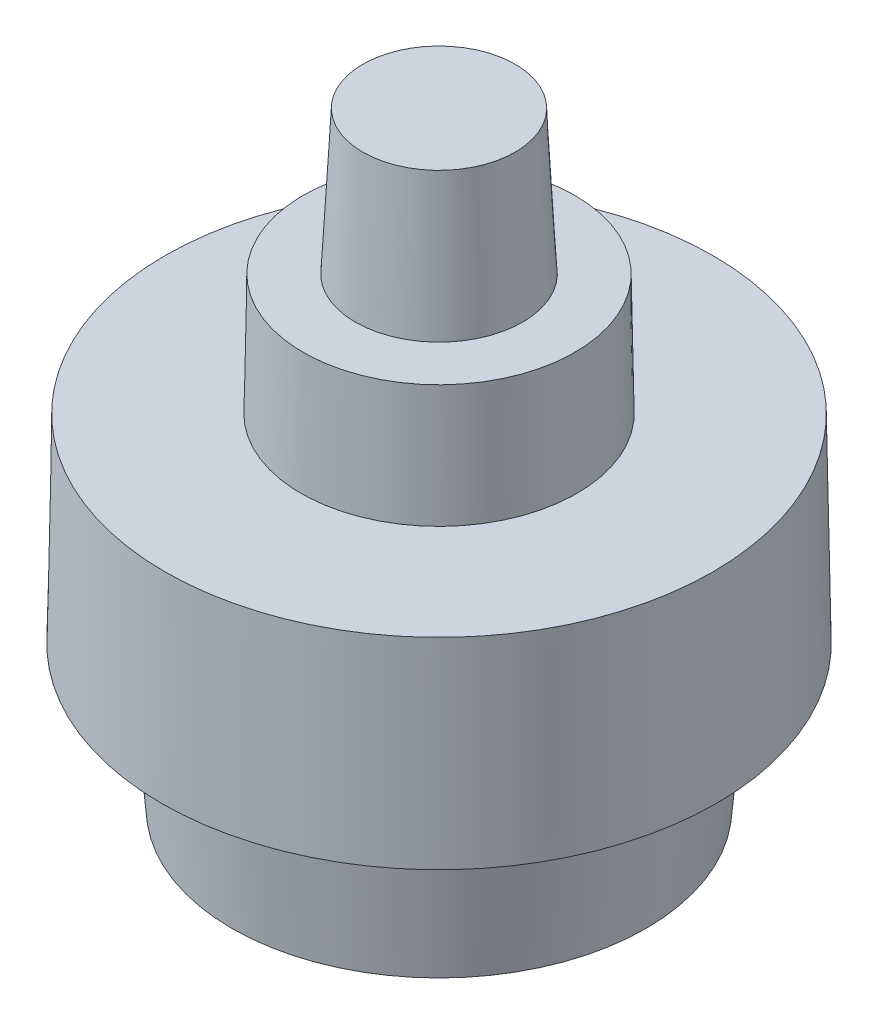
from build123d import *

# Parameters (mm, degrees)
SCALE1_SCALE             = 1.015
MOVE_START               = -3.416970763
MOVE_FACE1_OUTLINE_R     = 56.84
MOVE_FACE1_OUTLINE_R_2   = 45.72
MOVE_FACE1_DEPTH         = 31.42
MOVE_START_2             = 28.003029237
MOVE_FACE1_2_OUTLINE_R   = 28.42
MOVE_FACE1_2_OUTLINE_R_2 = 17.3
MOVE_FACE1_2_DEPTH       = 35.48
SKETCH2_R                = 17.5
BOSS_EXTRUDE1_DEPTH      = 30
BOSS_EXTRUDE1_TAPER      = 3
SKETCH3_R                = 45.92
BOSS_EXTRUDE2_DEPTH      = 30
BOSS_EXTRUDE2_TAPER      = 5
SHELL1_T                 = -0.2
SHELL2_T                 = -0.2


# Read off the part's stored shape, not the designer's step: Move Face1, Draft1
with BuildPart() as part:
    # Sketch1 → Revolve1 (revolve)
    with BuildSketch(Plane.XY, mode=Mode.PRIVATE) as revolve1_sk:
        Polygon((56, 0), (48, 0), (48, 28), (20, 28), (20, 60), (28, 60), (28, 38), (56, 38), align=None)
    revolve(revolve1_sk.sketch.rotate(Axis((0, 93.493183641, 0), (0, -1, 0)), 90), axis=Axis((0, 93.493183641, 0), (0, -1, 0)))


with BuildPart() as part_1:
    # Scale1: scaled about (0, 27.798050893, 0)
    add(part.part.scale(SCALE1_SCALE).moved(Location((0, -0.416970763, 0))))

    # Move Face1 outline → Move Face1 (add)
    with BuildSketch(Plane(origin=(0, 0, 0), x_dir=(1, 0, 0), z_dir=(0, 1, 0)).offset(MOVE_START)):
        Circle(MOVE_FACE1_OUTLINE_R)
        Circle(MOVE_FACE1_OUTLINE_R_2, mode=Mode.SUBTRACT)
    extrude(amount=MOVE_FACE1_DEPTH)

    # Move Face1 2 outline → Move Face1 2 (add)
    with BuildSketch(Plane(origin=(0, 0, 0), x_dir=(1, 0, 0), z_dir=(0, 1, 0)).offset(MOVE_START_2)):
        Circle(MOVE_FACE1_2_OUTLINE_R)
        Circle(MOVE_FACE1_2_OUTLINE_R_2, mode=Mode.SUBTRACT)
    extrude(amount=MOVE_FACE1_2_DEPTH)

    # Draft1 outline → Draft1 (revolve)
    with BuildSketch(Plane.XY):
        Polygon((56.84, -3.416970763), (58.007743844, -3.416970763), (57.282136795, 38.153029237), (56.84, 38.153029237), align=None)
        Polygon((28.42, 38.153029237), (28.862136795, 38.153029237), (28.42, 63.483029237), align=None)
    revolve(axis=Axis((0, 0, 0), (0, 1, 0)))


with BuildPart() as body_2:
    # Sketch2 → Boss-Extrude1 (new body)
    with BuildSketch(Plane(origin=(0, 63.483029237, 0), x_dir=(1, 0, 0), z_dir=(0, 1, 0))):
        Circle(SKETCH2_R)
    extrude(amount=BOSS_EXTRUDE1_DEPTH, taper=BOSS_EXTRUDE1_TAPER)

    # Shell1
    shell1_openings = [body_2.faces().sort_by_distance(p)[0] for p in [
        (0, 63.483029237, 0),
    ]]
    offset(amount=SHELL1_T, openings=shell1_openings, kind=Kind.INTERSECTION)


with BuildPart() as body_3:
    # Sketch3 → Boss-Extrude2 (new body)
    with BuildSketch(Plane.XZ.offset(3.416970763)):
        Circle(SKETCH3_R)
    extrude(amount=BOSS_EXTRUDE2_DEPTH, taper=BOSS_EXTRUDE2_TAPER)

    # Shell2
    shell2_openings = [body_3.faces().sort_by_distance(p)[0] for p in [
        (0, -3.416970763, 0),
    ]]
    offset(amount=SHELL2_T, openings=shell2_openings, kind=Kind.INTERSECTION)


solid = Compound([part_1.part, body_2.part, body_3.part])
